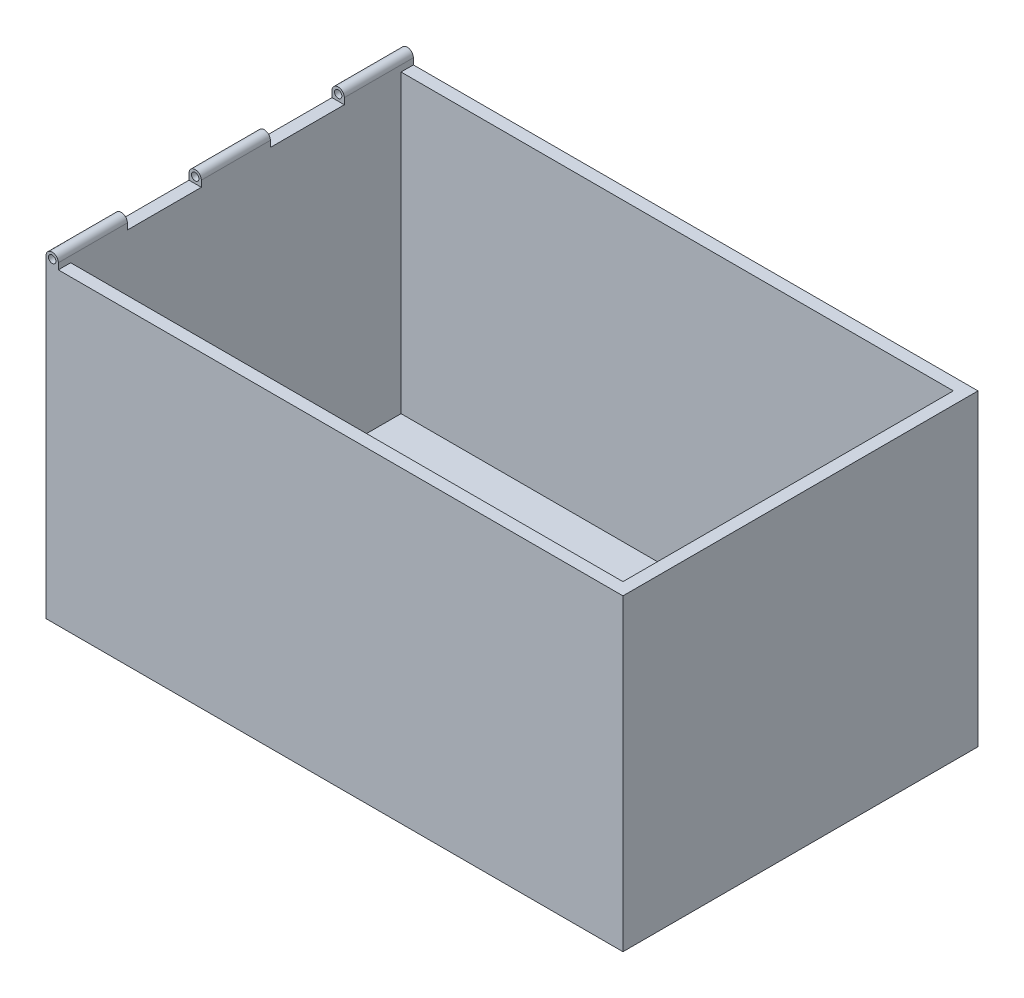
from build123d import *

# Parameters (mm, degrees)
SKETCH1_W               = 117
SKETCH1_H               = 72
BOSS_EXTRUDE1_DEPTH     = 2.5
SKETCH2_W               = 117
SKETCH2_H               = 72
SKETCH2_W_2             = 112
SKETCH2_H_2             = 67
BOSS_EXTRUDE2_DEPTH     = 60
SKETCH3_R               = 0.75
BOSS_EXTRUDE3_DEPTH     = 36
CUT_EXTRUDE1_DEPTH      = 93.868186157
CUT_EXTRUDE1_DEPTH_BACK = 93.868186157
SKETCH4_W               = 15
SKETCH4_H               = 2.5


with BuildPart() as part:
    # Sketch1 → Boss-Extrude1 (new body)
    with BuildSketch(Plane(origin=(0, 0, 0), x_dir=(1, 0, 0), z_dir=(0, 1, 0))):
        Rectangle(SKETCH1_W, SKETCH1_H)
    extrude(amount=-BOSS_EXTRUDE1_DEPTH)

    # Sketch2 → Boss-Extrude2 (add)
    with BuildSketch(Plane(origin=(0, 0, 0), x_dir=(1, 0, 0), z_dir=(0, 1, 0))):
        Rectangle(SKETCH2_W, SKETCH2_H)
        Rectangle(SKETCH2_W_2, SKETCH2_H_2, mode=Mode.SUBTRACT)
    extrude(amount=BOSS_EXTRUDE2_DEPTH)

    # Sketch3 → Boss-Extrude3 (add, symmetric)
    with BuildSketch(Plane.XY):
        with BuildLine():
            Line((-58.5, 61.25), (-58.5, 60))
            Line((-58.5, 60), (-56, 60))
            Line((-56, 60), (-56, 61.25))
            ThreePointArc((-56, 61.25), (-57.25, 62.5), (-58.5, 61.25))
        make_face()
        with Locations((-57.25, 61.25)):
            Circle(SKETCH3_R, mode=Mode.SUBTRACT)
    extrude(amount=BOSS_EXTRUDE3_DEPTH, both=True)

    # Sketch4 → Cut-Extrude1 (cut, two sides: drawn at the far end of the back side and taken through both)
    with BuildSketch(Plane(origin=(0, 0, 0), x_dir=(0, 0, -1), z_dir=(1, 0, 0)).offset(-CUT_EXTRUDE1_DEPTH_BACK)):
        with Locations((-14.5, 61.25)):
            Rectangle(SKETCH4_W, SKETCH4_H)
        with Locations((14.5, 61.25)):
            Rectangle(SKETCH4_W, SKETCH4_H)
    extrude(amount=CUT_EXTRUDE1_DEPTH + CUT_EXTRUDE1_DEPTH_BACK, mode=Mode.SUBTRACT)


solid = part.part
